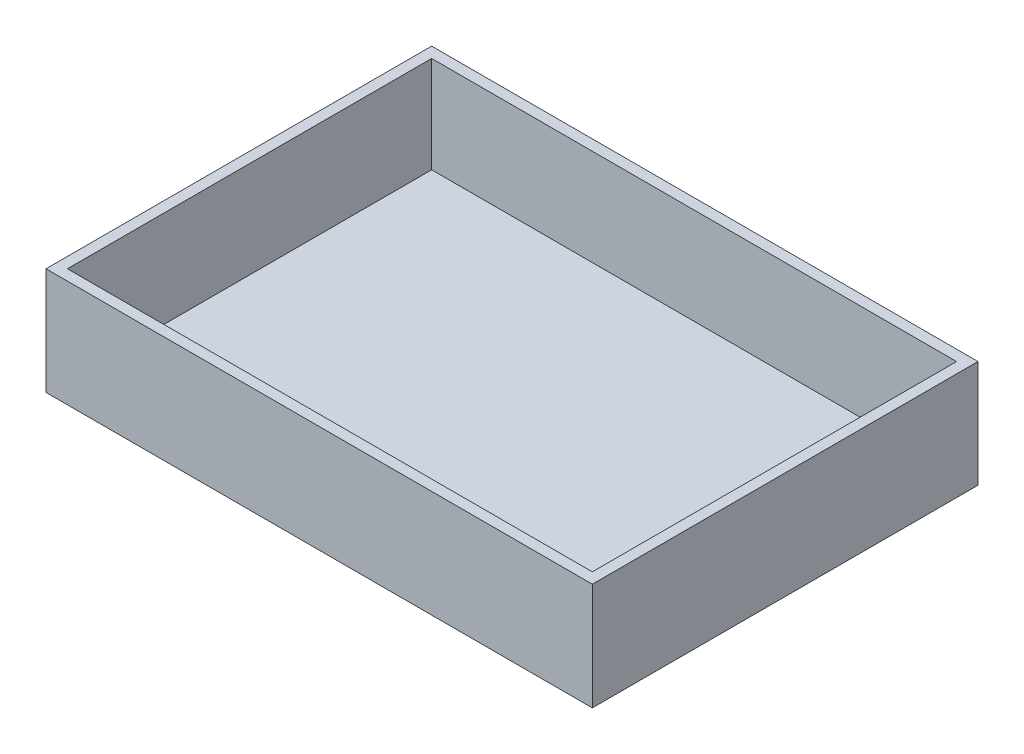
from build123d import *

# Parameters (mm, degrees)
SKETCH1_W           = 153
SKETCH1_H           = 108
BOSS_EXTRUDE1_DEPTH = 30
SHELL1_T            = -3


with BuildPart() as part:
    # Sketch1 → Boss-Extrude1 (new body)
    with BuildSketch(Plane(origin=(0, 0, 0), x_dir=(1, 0, 0), z_dir=(0, 1, 0))):
        with Locations((-76.5, -54)):
            Rectangle(SKETCH1_W, SKETCH1_H)
    extrude(amount=BOSS_EXTRUDE1_DEPTH)

    # Shell1
    shell1_openings = [part.faces().sort_by_distance(p)[0] for p in [
        (-76.5, 30, 54),
    ]]
    offset(amount=SHELL1_T, openings=shell1_openings, kind=Kind.INTERSECTION)


solid = part.part
